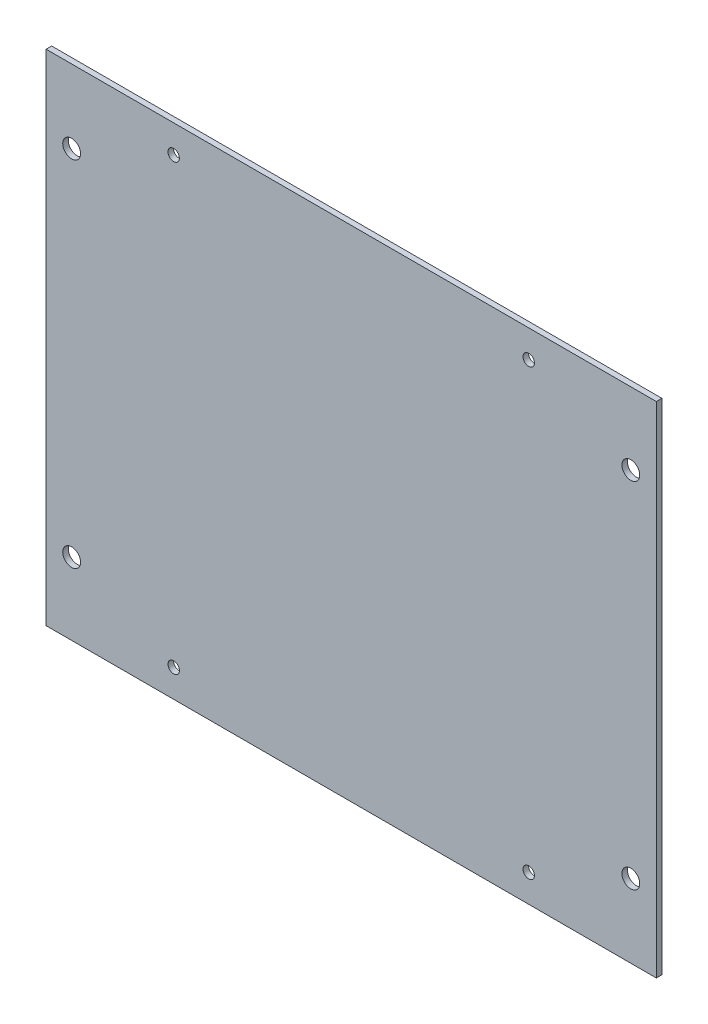
from build123d import *

# Parameters (mm, degrees)
SKETCH3_W              = 914.4
SKETCH3_H              = 609.6
BOSS_EXTRUDE1_DEPTH    = 0.79375
SKETCH4_OUTSIDE_W      = 1136.194
SKETCH4_OUTSIDE_H      = 831.394
SKETCH4_OUTSIDE_W_2    = 174.625
SKETCH4_OUTSIDE_H_2    = 142.875
CUT_EXTRUDE1_DEPTH     = 2.54
F_4_CLEARANCE_HOLE1_D  = 3.2639
F_10_CLEARANCE_HOLE1_D = 5.1054


with BuildPart() as part:
    # Sketch3 → Boss-Extrude1 (new, symmetric)
    with BuildSketch(Plane.XY):
        Rectangle(SKETCH3_W, SKETCH3_H)
    extrude(amount=BOSS_EXTRUDE1_DEPTH, both=True)

    # Sketch4 outside → Cut-Extrude1 (cut)
    with BuildSketch(Plane(origin=(0, 0, -0.79375), x_dir=(-1, 0, 0), z_dir=(0, 0, -1))):
        Rectangle(SKETCH4_OUTSIDE_W, SKETCH4_OUTSIDE_H)
        with Locations((306.247206985, -11.515137804)):
            Rectangle(SKETCH4_OUTSIDE_W_2, SKETCH4_OUTSIDE_H_2, mode=Mode.SUBTRACT)
    extrude(amount=-CUT_EXTRUDE1_DEPTH, mode=Mode.SUBTRACT)

    # #4 Clearance Hole1 (through all)
    with Locations(Plane(origin=(0, 0, -0.79375), x_dir=(-1, 0, 0), z_dir=(0, 0, -1))):
        with Locations((255.447206985, -75.015137804), (357.065534985, 51.959462196), (357.047206985, -75.015137804), (255.447206985, 51.984862196)):
            Hole(F_4_CLEARANCE_HOLE1_D / 2)

    # #10 Clearance Hole1 (through all)
    with Locations(Plane(origin=(0, 0, -0.79375), x_dir=(-1, 0, 0), z_dir=(0, 0, -1))):
        with Locations((226.237206985, -61.959537804), (226.237206985, 39.284562202), (386.257206985, 38.929262196), (386.257206985, -62.31483781)):
            Hole(F_10_CLEARANCE_HOLE1_D / 2)


solid = part.part
